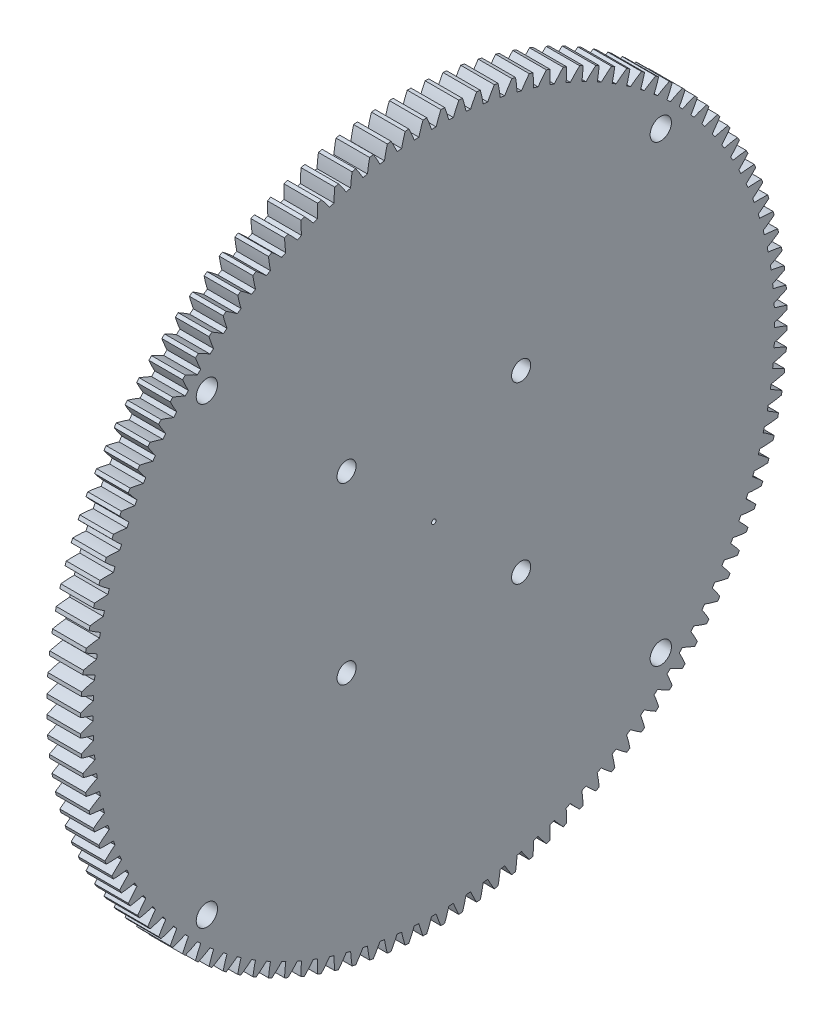
from build123d import *

# Parameters (mm, degrees)
BASPROSKE_W        = 6
BASPROSKE_H        = 63
TOOTHCUT_DEPTH     = 90.297256397
TEETHCUTS_COUNT    = 124
TEETHCUTS_ANGLE    = 357.096774194
BORSKE_R           = 0.4
BORE_DEPTH         = 50.0000508
CUT_EXTRUDE2_REACH = 91.28
SKETCH3_R          = 1.9
CIRPATTERN1_COUNT  = 4
CUT_EXTRUDE3_REACH = 91.28
SKETCH5_R          = 1.7
CIRPATTERN2_COUNT  = 4


with BuildPart() as part:
    # BasProSke → Base-Revolve (revolve)
    with BuildSketch(Plane(origin=(0, 0, 0), x_dir=(1, 0, 0), z_dir=(0, 1, 0)), mode=Mode.PRIVATE) as base_revolve_sk:
        with Locations((3, 31.5)):
            Rectangle(BASPROSKE_W, BASPROSKE_H)
    revolve(base_revolve_sk.sketch.rotate(Axis((-10, 0, 0), (1, 0, 0)), 180), axis=Axis((-10, 0, 0), (1, 0, 0)))

    # TooCutSke → ToothCut (cut, through all)
    with BuildSketch(Plane(origin=(0, 0, 0), x_dir=(0, 0, -1), z_dir=(1, 0, 0))):
        with BuildLine():
            ThreePointArc((0.410069445, 60.747615954), (0, 60.749), (-0.410069445, 60.747615954))
            ThreePointArc((-0.410069445, 60.747615954), (-0.812309184, 61.890616344), (-1.269898411, 63.012605113))
            ThreePointArc((-1.269898411, 63.012605113), (0, 63.0254), (1.269898411, 63.012605113))
            ThreePointArc((1.269898411, 63.012605113), (0.812309184, 61.890616344), (0.410069445, 60.747615954))
        make_face()
    toothcut = extrude(amount=TOOTHCUT_DEPTH, mode=Mode.SUBTRACT)

    # TeethCuts: ToothCut ×124 about axis
    teethcuts_axis = Axis((-10, 0, 0), (1, 0, 0))
    for i in range(1, TEETHCUTS_COUNT):
        add(toothcut.rotate(teethcuts_axis, i * TEETHCUTS_ANGLE / (TEETHCUTS_COUNT - 1)), mode=Mode.SUBTRACT)

    # BorSke → Bore (cut, symmetric)
    with BuildSketch(Plane(origin=(0, 0, 0), x_dir=(0, 0, -1), z_dir=(1, 0, 0))):
        with Locations(Location((0, 0, 0), (0, 0, 180))):
            Circle(BORSKE_R)
    extrude(amount=BORE_DEPTH, both=True, mode=Mode.SUBTRACT)

    # Sketch3 → Cut-Extrude2 (cut, up to next)
    with BuildSketch(Plane.ZY, mode=Mode.PRIVATE) as cut_extrude2_sk1:
        with Locations((-40.449972707, 40.449972707)):
            Circle(SKETCH3_R)
    cut_extrude2_tool1 = extrude(cut_extrude2_sk1.sketch, amount=-CUT_EXTRUDE2_REACH, mode=Mode.PRIVATE) & part.part
    cut_extrude2 = cut_extrude2_tool1.solids().sort_by_distance((0, 40.449973, -40.449973))[0]
    add(cut_extrude2, mode=Mode.SUBTRACT)

    # CirPattern1: Cut-Extrude2 ×4 about axis
    cirpattern1_axis = Axis((0, 0, 0), (1, 0, 0))
    for i in range(1, CIRPATTERN1_COUNT):
        add(cut_extrude2.rotate(cirpattern1_axis, i * 360 / CIRPATTERN1_COUNT), mode=Mode.SUBTRACT)

    # Sketch5 → Cut-Extrude3 (cut, up to next)
    with BuildSketch(Plane.ZY, mode=Mode.PRIVATE) as cut_extrude3_sk1:
        with Locations((-15.556349186, 15.556349186)):
            Circle(SKETCH5_R)
    cut_extrude3_tool1 = extrude(cut_extrude3_sk1.sketch, amount=-CUT_EXTRUDE3_REACH, mode=Mode.PRIVATE) & part.part
    cut_extrude3 = cut_extrude3_tool1.solids().sort_by_distance((0, 15.556349, -15.556349))[0]
    add(cut_extrude3, mode=Mode.SUBTRACT)

    # CirPattern2: Cut-Extrude3 ×4 about axis
    cirpattern2_axis = Axis((0, 0, 0), (1, 0, 0))
    for i in range(1, CIRPATTERN2_COUNT):
        add(cut_extrude3.rotate(cirpattern2_axis, i * 360 / CIRPATTERN2_COUNT), mode=Mode.SUBTRACT)


solid = part.part
